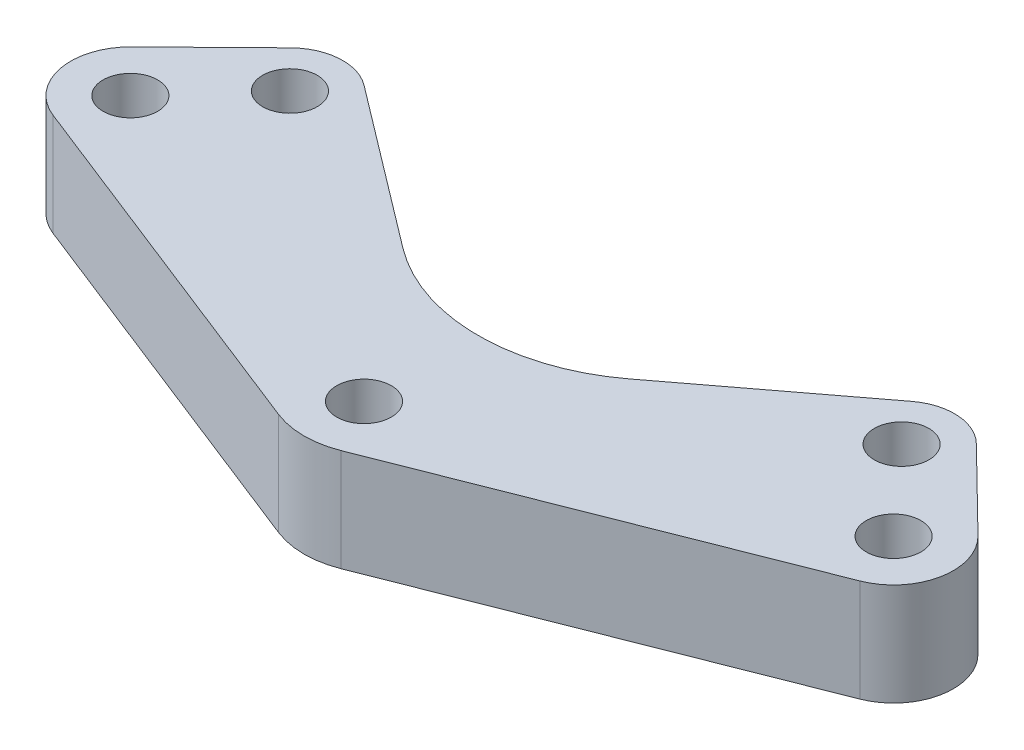
from build123d import *

# Parameters (mm, degrees)
ESBO_O1_R                = 1.6
RESSALTO_EXTRUS_O1_DEPTH = 6


with BuildPart() as part:
    # Esboço1 → Ressalto-extrusão1 (new body)
    with BuildSketch(Plane.XZ.offset(6)):
        with BuildLine():
            Line((23.658239146, -5.419790473), (1.830835365, 3.169198905))
            ThreePointArc((1.830835365, 3.169198905), (0, 3.516453278), (-1.830835365, 3.169198905))
            Line((-1.830835365, 3.169198905), (-23.658239146, -5.419790473))
            ThreePointArc((-23.658239146, -5.419790473), (-25.806836409, -7.98111819), (-24.825744035, -11.177104364))
            Line((-24.825744035, -11.177104364), (-20.101514858, -15.804403192))
            ThreePointArc((-20.101514858, -15.804403192), (-18.128320556, -16.683568025), (-16.059952818, -16.060445681))
            Line((-16.059952818, -16.060445681), (-6.643887712, -8.924606384))
            ThreePointArc((-6.643887712, -8.924606384), (0, -6.691518958), (6.643887712, -8.924606384))
            Line((6.643887712, -8.924606384), (16.059952818, -16.060445681))
            ThreePointArc((16.059952818, -16.060445681), (18.128320556, -16.683568025), (20.101514858, -15.804403192))
            Line((20.101514858, -15.804403192), (24.825744035, -11.177104364))
            ThreePointArc((24.825744035, -11.177104364), (25.806836409, -7.98111819), (23.658239146, -5.419790473))
        make_face()
        with Locations((-17.932321173, -13.589770319)):
            Circle(ESBO_O1_R, mode=Mode.SUBTRACT)
        Circle(ESBO_O1_R, mode=Mode.SUBTRACT)
        with Locations((17.932321173, -13.589770319)):
            Circle(ESBO_O1_R, mode=Mode.SUBTRACT)
        with Locations((-22.376654391, -8.676712411)):
            Circle(ESBO_O1_R, mode=Mode.SUBTRACT)
        with Locations((22.376654391, -8.676712411)):
            Circle(ESBO_O1_R, mode=Mode.SUBTRACT)
    extrude(amount=-RESSALTO_EXTRUS_O1_DEPTH)


solid = part.part
